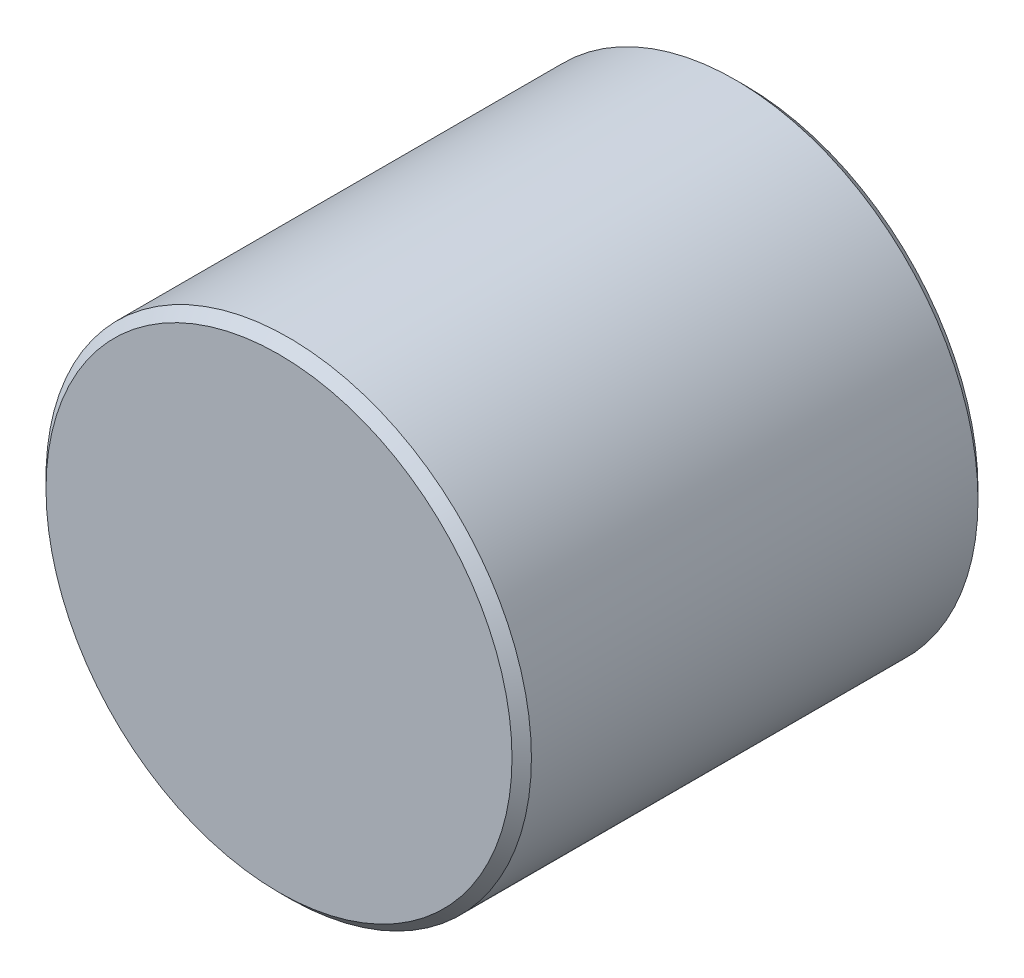
from build123d import *

# Parameters (mm, degrees)
SKETCH1_R           = 2.5
BOSS_EXTRUDE1_DEPTH = 4.8
CHAMFER1_SIZE       = 0.1


with BuildPart() as part:
    # Sketch1 → Boss-Extrude1 (new body)
    with BuildSketch(Plane.XY):
        Circle(SKETCH1_R)
    extrude(amount=BOSS_EXTRUDE1_DEPTH)

    # Chamfer1
    chamfer1_edges = [part.edges().sort_by_distance(p)[0] for p in [
        (-2.5, 0, 0),
        (-2.5, 0, 4.8),
    ]]
    chamfer(chamfer1_edges, length=CHAMFER1_SIZE)


solid = part.part
